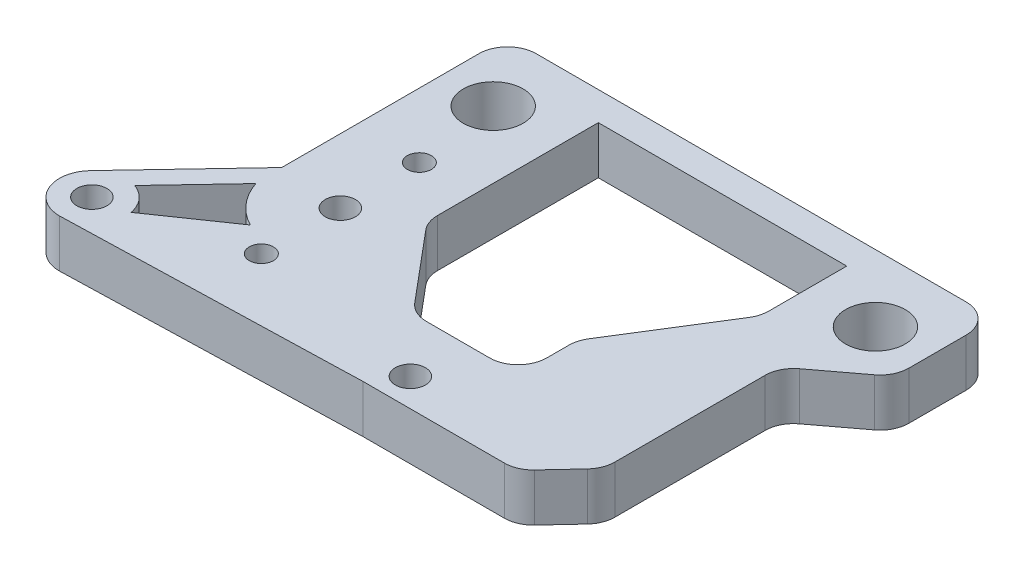
from build123d import *

# Parameters (mm, degrees)
SKETCH4_R           = 2
SKETCH4_R_2         = 3
SKETCH4_R_3         = 1.6
SKETCH4_R_4         = 3.96875
BOSS_EXTRUDE2_DEPTH = 6.35
SKETCH11_R          = 3
BOSS_EXTRUDE4_DEPTH = 3.35
SKETCH12_R          = 2
CUT_EXTRUDE1_DEPTH  = 65.17061253


with BuildPart() as part:
    # Sketch4 → Boss-Extrude2 (new body)
    with BuildSketch(Plane(origin=(0, 0, 0), x_dir=(1, 0, 0), z_dir=(0, 1, 0))):
        with BuildLine():
            Line((21.46596982, -18.4375), (40.257702493, -18.4375))
            ThreePointArc((40.257702493, -18.4375), (41.776936446, -18.121498883), (43.044160097, -17.225913752))
            Line((43.044160097, -17.225913752), (46.444939319, -13.579024524))
            ThreePointArc((46.444939319, -13.579024524), (47.203372649, -12.376980446), (47.468481715, -10.980610773))
            Line((47.468481715, -10.980610773), (47.468481715, 8.985116992))
            ThreePointArc((47.468481715, 8.985116992), (47.868781798, 10.685130659), (48.985566477, 12.027918285))
            Line((48.985566477, 12.027918285), (54.680415238, 16.319294633))
            ThreePointArc((54.680415238, 16.319294633), (55.797199918, 17.662082259), (56.1975, 19.362095927))
            Line((56.1975, 19.362095927), (56.1975, 26.9875))
            ThreePointArc((56.1975, 26.9875), (55.081576836, 29.681576836), (52.3875, 30.7975))
            Line((52.3875, 30.7975), (-4.7625, 30.7975))
            ThreePointArc((-4.7625, 30.7975), (-7.456576836, 29.681576836), (-8.5725, 26.9875))
            Line((-8.5725, 26.9875), (-8.5725, 0.781747009))
            Line((-8.5725, 0.781747009), (-20.917416467, -12.27322702))
            ThreePointArc((-20.917416467, -12.27322702), (-21.745832178, -16.948010286), (-17.78, -19.558))
            Line((-17.78, -19.558), (21.46596982, -18.4375))
        make_face()
        with Locations((-17.78, -15.24)):
            Circle(SKETCH4_R, mode=Mode.SUBTRACT)
        with BuildLine():
            Line((-4.038317295, -7.919854381), (-13.417009712, -14.390093684))
            ThreePointArc((-13.417009712, -14.390093684), (-14.405104402, -12.347232345), (-16.272811714, -11.058324681))
            Line((-16.272811714, -11.058324681), (-8.444304622, -2.779535833))
            ThreePointArc((-8.444304622, -2.779535833), (-6.749791195, -5.78553531), (-4.038317295, -7.919854381))
        make_face(mode=Mode.SUBTRACT)
        Circle(SKETCH4_R_2, mode=Mode.SUBTRACT)
        with Locations((24.012521227, -14.703599027)):
            Circle(SKETCH4_R, mode=Mode.SUBTRACT)
        with Locations((0, 10.5)):
            Circle(SKETCH4_R_3, mode=Mode.SUBTRACT)
        with Locations((-1.5875, 21.9075)):
            Circle(SKETCH4_R_4, mode=Mode.SUBTRACT)
        with BuildLine():
            Line((7.3025, 26.9875), (40.3225, 26.9875))
            Line((40.3225, 26.9875), (40.3225, 16.611657969))
            ThreePointArc((40.3225, 16.611657969), (40.174907062, 15.561479644), (39.743563246, 14.592665573))
            Line((39.743563246, 14.592665573), (31.537418469, 1.460088735))
            ThreePointArc((31.537418469, 1.460088735), (31.106074654, 0.491274664), (30.958481715, -0.558903662))
            Line((30.958481715, -0.558903662), (30.958481715, -3.507298313))
            ThreePointArc((30.958481715, -3.507298313), (29.842558552, -6.20137515), (27.148481715, -7.317298313))
            Line((27.148481715, -7.317298313), (18.766481715, -7.317298313))
            ThreePointArc((18.766481715, -7.317298313), (17.156306138, -6.960330982), (15.847852387, -5.956319106))
            Line((15.847852387, -5.956319106), (8.193870672, 3.165341101))
            ThreePointArc((8.193870672, 3.165341101), (7.532271115, 4.311265148), (7.3025, 5.614361894))
            Line((7.3025, 5.614361894), (7.3025, 26.9875))
        make_face(mode=Mode.SUBTRACT)
        with Locations((49.2125, 21.9075)):
            Circle(SKETCH4_R_4, mode=Mode.SUBTRACT)
        with Locations((0, -10.5)):
            Circle(SKETCH4_R_3, mode=Mode.SUBTRACT)
    extrude(amount=-BOSS_EXTRUDE2_DEPTH)

    # Sketch11 → Boss-Extrude4 (add)
    with BuildSketch(Plane(origin=(0, 0, 0), x_dir=(1, 0, 0), z_dir=(0, 1, 0))):
        Circle(SKETCH11_R)
    extrude(amount=-BOSS_EXTRUDE4_DEPTH)

    # Sketch12 → Cut-Extrude1 (cut, through all)
    with BuildSketch(Plane.XZ.offset(3.35)):
        Circle(SKETCH12_R)
    extrude(amount=-CUT_EXTRUDE1_DEPTH, mode=Mode.SUBTRACT)


solid = part.part
